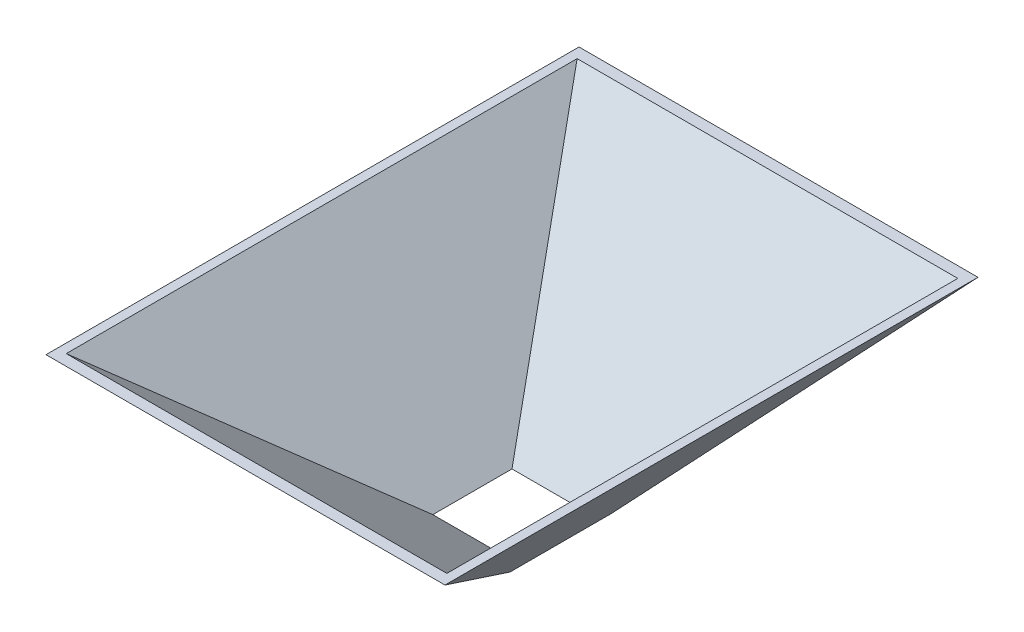
from build123d import *

# Parameters (mm, degrees)
CUT_EXTRUDE1_DEPTH      = 1294.338702909
CUT_EXTRUDE1_DEPTH_BACK = 1294.338702909
SKETCH3_W               = 1780
SKETCH3_H               = 650
SHELL1_T                = 2


with BuildPart() as part:
    # Boundary1: read off the stored shape, not the designer's step
    # Boundary1: loft between two sections, ruled curve by curve
    boundary1_from = [
        Edge.make_line((625, 700, -890), (625, 700, 890)),
        Edge.make_line((625, 700, 890), (-625, 700, 890)),
        Edge.make_line((-625, 700, 890), (-625, 700, -890)),
        Edge.make_line((-625, 700, -890), (625, 700, -890)),
    ]
    boundary1_to = [
        Edge.make_line((11.5, 0, -11.5), (11.5, 0, 11.5)),
        Edge.make_line((11.5, 0, 11.5), (-11.5, 0, 11.5)),
        Edge.make_line((-11.5, 0, 11.5), (-11.5, 0, -11.5)),
        Edge.make_line((-11.5, 0, -11.5), (11.5, 0, -11.5)),
    ]
    boundary1 = Solid(Shell([*[Face.make_surface_from_curves(boundary1_from[k], boundary1_to[k]) for k in range(4)], Face(Wire(boundary1_from)), Face(Wire(boundary1_to))]))
    add(boundary1)

    # Sketch3 → Cut-Extrude1 (cut, two sides: drawn at the far end of the back side and taken through both)
    with BuildSketch(Plane(origin=(0, 0, 0), x_dir=(0, 0, -1), z_dir=(1, 0, 0)).offset(-CUT_EXTRUDE1_DEPTH_BACK)):
        with Locations((0, 375)):
            Rectangle(SKETCH3_W, SKETCH3_H)
    extrude(amount=CUT_EXTRUDE1_DEPTH + CUT_EXTRUDE1_DEPTH_BACK, mode=Mode.SUBTRACT)

    # Shell1
    shell1_openings = [part.faces().sort_by_distance(p)[0] for p in [
        (0, 0, 0),
        (0, 50, 0),
    ]]
    offset(amount=SHELL1_T, openings=shell1_openings, kind=Kind.INTERSECTION)


solid = part.part
